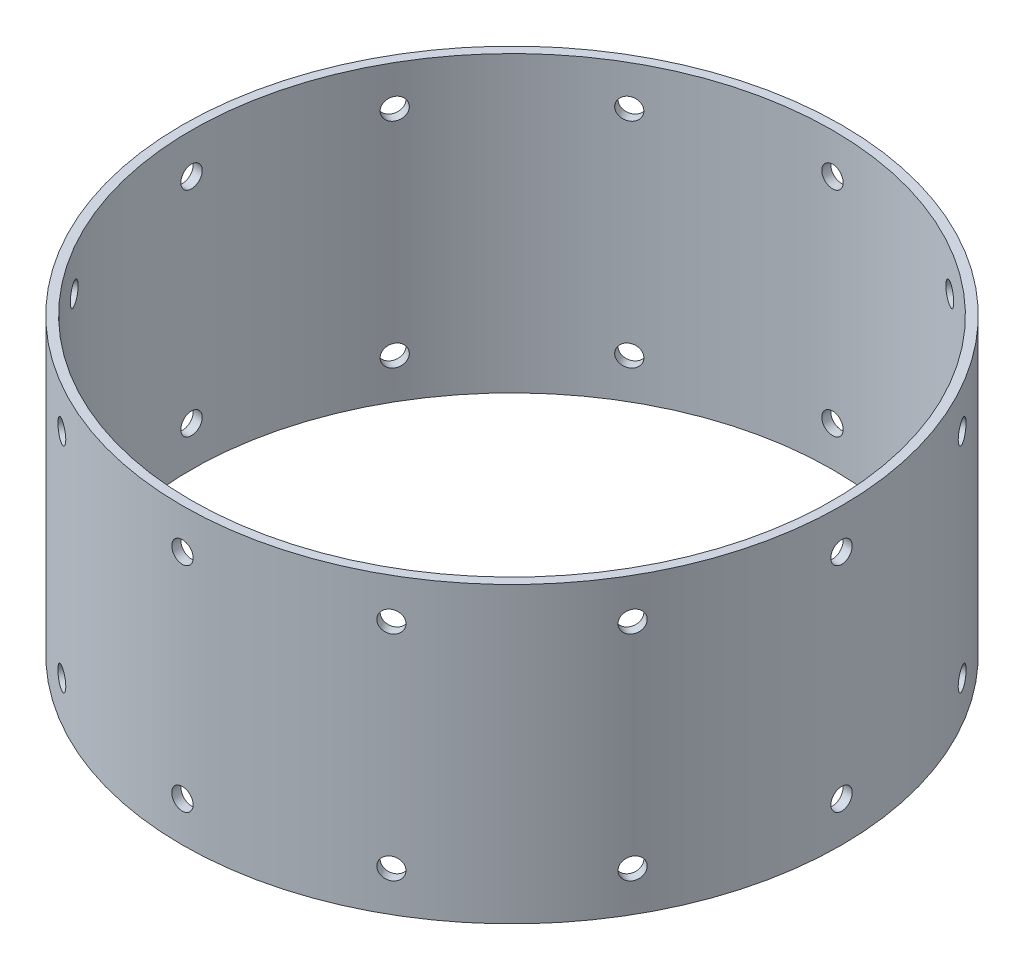
from build123d import *

# Parameters (mm, degrees)
SKETCH1_R           = 78.359
SKETCH1_R_2         = 76.2
BOSS_EXTRUDE1_DEPTH = 69.85
SKETCH2_R           = 2.54
CUT_EXTRUDE1_DEPTH  = 131.993466486
CIRPATTERN1_COUNT   = 12


with BuildPart() as part:
    # Sketch1 → Boss-Extrude1 (new body)
    with BuildSketch(Plane(origin=(0, 0, 0), x_dir=(1, 0, 0), z_dir=(0, 1, 0))):
        Circle(SKETCH1_R)
        Circle(SKETCH1_R_2, mode=Mode.SUBTRACT)
    extrude(amount=BOSS_EXTRUDE1_DEPTH)

    # Sketch2 → Cut-Extrude1 (cut, through all)
    with BuildSketch(Plane.XY):
        with Locations((0, 9.525)):
            Circle(SKETCH2_R)
        with Locations((0, 60.325)):
            Circle(SKETCH2_R)
    cut_extrude1 = extrude(amount=-CUT_EXTRUDE1_DEPTH, mode=Mode.SUBTRACT)

    # CirPattern1: Cut-Extrude1 ×12 about axis
    cirpattern1_axis = Axis((0, 0, 0), (0, 1, 0))
    for i in range(1, CIRPATTERN1_COUNT):
        add(cut_extrude1.rotate(cirpattern1_axis, i * 360 / CIRPATTERN1_COUNT), mode=Mode.SUBTRACT)


solid = part.part
